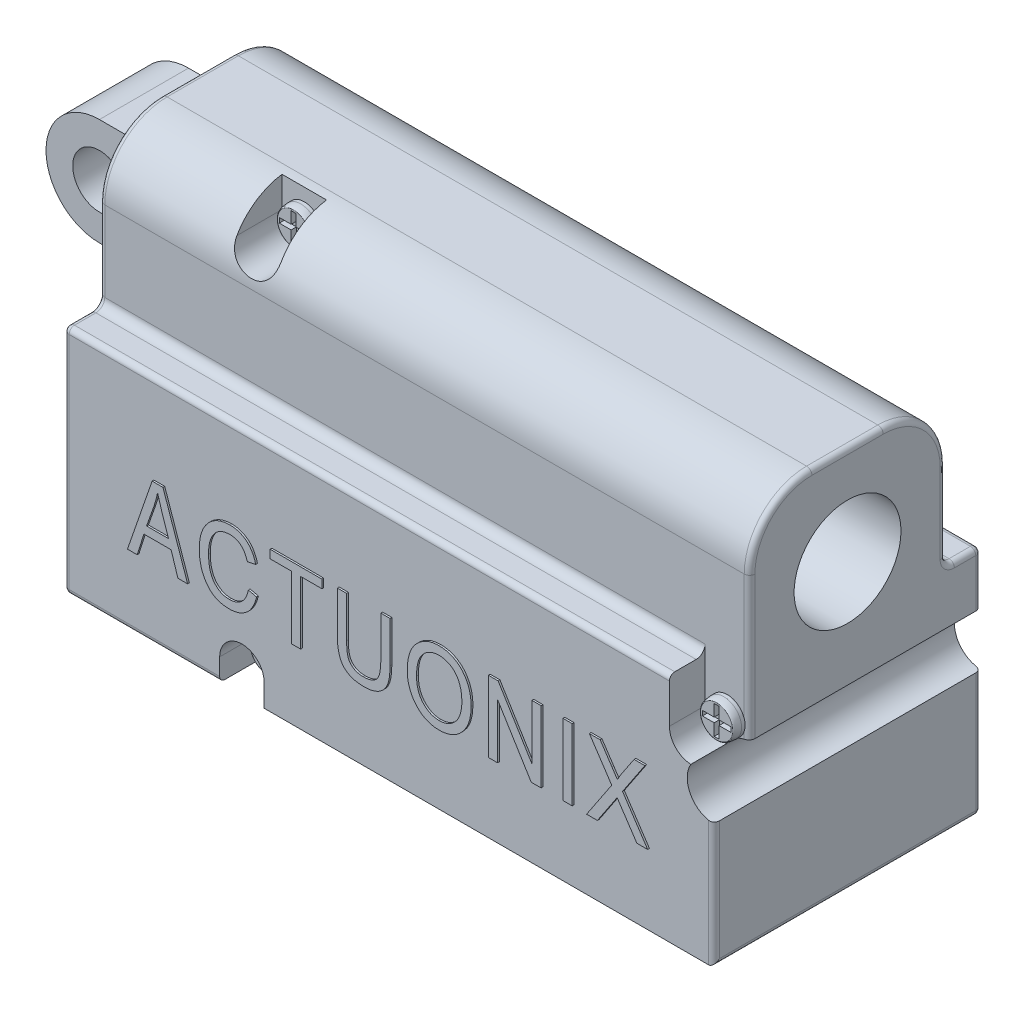
from build123d import *

# Parameters (mm, degrees)
SKETCH1_W             = 36.5
SKETCH1_H             = 21.5
BOSS_EXTRUDE1_DEPTH   = 7.5
SKETCH2_W             = 2
SKETCH2_H             = 8.5
CUT_EXTRUDE1_DEPTH    = 39.782244649
SKETCH3_W             = 5
SKETCH3_H             = 6
BOSS_EXTRUDE2_DEPTH   = 6
SKETCH4_R             = 1.5
CUT_EXTRUDE2_DEPTH    = 29.348280371
SKETCH5_R             = 1.5
CUT_EXTRUDE3_DEPTH    = 31.473349012
SKETCH7_W             = 0.51948052
SKETCH7_H             = 4
LETTERING_DEPTH       = 0.1
SKETCH8_W             = 0.5
SKETCH8_H             = 5.523886488
CUT_EXTRUDE5_DEPTH    = 1
BOSS_EXTRUDE4_DEPTH   = 0.1
SKETCH10_W            = 0.25
SKETCH10_H            = 5.523886488
WIRES_2_DEPTH         = 7
SKETCH11_W            = 0.5
SKETCH11_H            = 7
BOSS_EXTRUDE6_DEPTH   = 0.05
CUT_EXTRUDE6_DEPTH    = 2
CUT_EXTRUDE7_DEPTH    = 3
SKETCH14_R            = 1
BOSS_EXTRUDE7_DEPTH   = 0.6
BOSS_EXTRUDE7_2_DEPTH = 0.6
SKETCH15_W            = 0.6625
SKETCH15_H            = 0.275
SKETCH15_W_2          = 0.275
SKETCH15_H_2          = 0.6625
CUT_EXTRUDE8_DEPTH    = 0.3
SKETCH16_R            = 1
BOSS_EXTRUDE8_DEPTH   = 0.6
SKETCH17_W            = 0.275
SKETCH17_H            = 0.6625
SKETCH17_W_2          = 0.6625
SKETCH17_H_2          = 0.275
CUT_EXTRUDE9_DEPTH    = 0.3
FILLET6_SIZE          = 0.4
FILLET6_SIZE_2        = 0.1
FILLET7_SIZE          = 0.4
FILLET7_SIZE_2        = 0.1
FILLET8_SIZE          = 0.4
FILLET8_SIZE_2        = 0.1
FILLET1_R             = 3.5
FILLET2_R             = 1
FILLET3_R             = 0.5
FILLET4_R             = 0.5
FILLET5_R             = 0.3
SKETCH6_R             = 3
CUT_EXTRUDE4_DEPTH    = 25
SKETCH18_W            = 11.28780457
SKETCH18_H            = 8.884468651
CUT_EXTRUDE10_DEPTH   = 34.11547981


with BuildPart() as part:
    # Sketch1 → Boss-Extrude1 (new, symmetric)
    with BuildSketch(Plane.XY):
        Rectangle(SKETCH1_W, SKETCH1_H)
    extrude(amount=BOSS_EXTRUDE1_DEPTH, both=True)

    # Sketch2 → Cut-Extrude1 (cut, through all)
    with BuildSketch(Plane(origin=(18.25, 0, 0), x_dir=(0, 0, -1), z_dir=(1, 0, 0))):
        with Locations((-6.5, 6.5)):
            Rectangle(SKETCH2_W, SKETCH2_H)
        with Locations((6.5, 6.5)):
            Rectangle(SKETCH2_W, SKETCH2_H)
    extrude(amount=-CUT_EXTRUDE1_DEPTH, mode=Mode.SUBTRACT)

    # Sketch3 → Boss-Extrude2 (add)
    with BuildSketch(Plane.ZY.offset(18.25)):
        with Locations((0, 5.25)):
            Rectangle(SKETCH3_W, SKETCH3_H)
    extrude(amount=BOSS_EXTRUDE2_DEPTH)

    # Sketch4 → Cut-Extrude2 (cut, through all)
    with BuildSketch(Plane.XY.offset(2.5)):
        with BuildLine():
            ThreePointArc((-24.25, 5.25), (-23.371320344, 7.371320344), (-21.25, 8.25))
            Line((-21.25, 8.25), (-24.25, 8.25))
            Line((-24.25, 8.25), (-24.25, 5.25))
        make_face()
        with BuildLine():
            Line((-24.25, 2.25), (-21.25, 2.25))
            ThreePointArc((-21.25, 2.25), (-23.371320344, 3.128679656), (-24.25, 5.25))
            Line((-24.25, 5.25), (-24.25, 2.25))
        make_face()
        with Locations((-21.25, 5.25)):
            Circle(SKETCH4_R)
    extrude(amount=-CUT_EXTRUDE2_DEPTH, mode=Mode.SUBTRACT)

    # Sketch5 → Cut-Extrude3 (cut, through all)
    with BuildSketch(Plane.XY.offset(7.5)):
        with Locations((18.25, -2.25)):
            Circle(SKETCH5_R)
    extrude(amount=-CUT_EXTRUDE3_DEPTH, mode=Mode.SUBTRACT)

    # Sketch7 → Lettering (add)
    # profile 1 of 8: a face of its own
    with BuildSketch(Plane.XY.offset(7.5)):
        Polygon((-14.576623377, -6.75), (-13.191071429, -2.75), (-12.58474026, -2.75), (-11.2, -6.75), (-11.744642857, -6.75), (-12.125324675, -5.555194805), (-13.651298701, -5.555194805), (-14.031980519, -6.75), align=None)
        with BuildLine():
            Line((-13.501948052, -5.087662338), (-12.274675325, -5.087662338))
            Line((-12.274675325, -5.087662338), (-12.639935065, -3.988636364))
            add(Edge.make_bspline(
                [(-12.639935065, -3.988636364), (-12.65351375, -3.947527264), (-12.680027416, -3.86725786), (-12.717907401, -3.749746161), (-12.754167393, -3.63825963), (-12.786379727, -3.532378588), (-12.815469797, -3.432419975), (-12.842520621, -3.338609172), (-12.866920344, -3.250751988), (-12.881375447, -3.193748887), (-12.888311688, -3.166396104)],
                knots=[0, 0, 0, 0, 1.209410234, 2.361487807, 3.449058128, 4.484314046, 5.452976395, 6.357250795, 7.211731278, 8, 8, 8, 8], degree=3))
            add(Edge.make_bspline(
                [(-12.888311688, -3.166396104), (-12.901124878, -3.230075207), (-12.926741471, -3.357384774), (-12.973319058, -3.547258788), (-13.027450773, -3.736275415), (-13.069383114, -3.861081563), (-13.090422078, -3.923701299)],
                knots=[0, 0, 0, 0, 0.993501098, 1.986243324, 2.98962581, 4, 4, 4, 4], degree=3))
            Line((-13.090422078, -3.923701299), (-13.501948052, -5.087662338))
        make_face(mode=Mode.SUBTRACT)
    # profile 2 of 8: a face of its own
    with BuildSketch(Plane.XY.offset(7.5)):
        with BuildLine():
            Line((-7.792207792, -5.347402597), (-7.324675325, -5.451298701))
            add(Edge.make_bspline(
                [(-7.324675325, -5.451298701), (-7.338507843, -5.506447179), (-7.365542684, -5.614231621), (-7.418142329, -5.768179781), (-7.476165414, -5.912074032), (-7.542738908, -6.04496921), (-7.617774687, -6.166698293), (-7.698608355, -6.278963676), (-7.788572676, -6.379120178), (-7.885390202, -6.468700678), (-7.988420918, -6.547487897), (-8.097526444, -6.615465217), (-8.21190664, -6.673069348), (-8.331730731, -6.720257116), (-8.456909189, -6.757236415), (-8.587689795, -6.782430923), (-8.723834237, -6.799756731), (-8.816502321, -6.801209252), (-8.863636364, -6.801948052)],
                knots=[0, 0, 0, 0, 1.220293167, 2.384990924, 3.489669754, 4.549651254, 5.57188532, 6.557220986, 7.51582152, 8.457228578, 9.385586102, 10.296327526, 11.213420288, 12.131450933, 13.057916225, 14.011504525, 14.988585638, 16, 16, 16, 16], degree=3))
            add(Edge.make_bspline(
                [(-8.863636364, -6.801948052), (-8.905058048, -6.801419118), (-8.986688304, -6.80037674), (-9.106460448, -6.789348014), (-9.221790988, -6.772704962), (-9.332301166, -6.747983357), (-9.438876482, -6.717626517), (-9.540431245, -6.679115624), (-9.637597996, -6.634671315), (-9.729668118, -6.582173073), (-9.818184169, -6.52293947), (-9.901393032, -6.454223711), (-9.981739073, -6.378558724), (-10.056960745, -6.293706075), (-10.128817557, -6.200858259), (-10.195643045, -6.099262848), (-10.259460729, -5.989995939), (-10.318128719, -5.872834798), (-10.372152418, -5.748765883), (-10.417667338, -5.617992469), (-10.45807264, -5.48252656), (-10.489241164, -5.341069606), (-10.514621378, -5.194576317), (-10.531927893, -5.042251512), (-10.544131522, -4.884668646), (-10.545008707, -4.777621958), (-10.545454545, -4.723214286)],
                knots=[0, 0, 0, 0, 0.987444875, 1.945970532, 2.865691915, 3.764214811, 4.644225399, 5.505809035, 6.35159498, 7.189444901, 8.03046832, 8.887959934, 9.759606025, 10.659725721, 11.58885776, 12.556911331, 13.557234418, 14.604595256, 15.679628512, 16.781526208, 17.904378674, 19.048529781, 20.233287979, 21.448073357, 22.70295484, 24, 24, 24, 24], degree=3))
            add(Edge.make_bspline(
                [(-10.545454545, -4.723214286), (-10.545011349, -4.66961834), (-10.544141797, -4.564463033), (-10.531999977, -4.410110988), (-10.514590546, -4.261860909), (-10.489608069, -4.119785185), (-10.456867106, -3.984140374), (-10.418547579, -3.854397692), (-10.370736364, -3.731716174), (-10.317802854, -3.61476854), (-10.257196775, -3.505175571), (-10.19226788, -3.401844132), (-10.12266503, -3.304803719), (-10.046935004, -3.21551783), (-9.966492373, -3.133172157), (-9.88076966, -3.058318847), (-9.790363002, -2.989688546), (-9.694774651, -2.928209444), (-9.595035603, -2.874060447), (-9.492559875, -2.826818588), (-9.387380921, -2.786790523), (-9.279140063, -2.754317756), (-9.167928456, -2.729124127), (-9.053719381, -2.711644238), (-8.936952756, -2.69943788), (-8.85798646, -2.698516426), (-8.818181818, -2.698051948)],
                knots=[0, 0, 0, 0, 1.28714434, 2.525378668, 3.716880711, 4.871983872, 5.988084826, 7.067553269, 8.118870607, 9.148405561, 10.148997021, 11.124535523, 12.078797495, 13.015004836, 13.934205159, 14.841541352, 15.746266633, 16.658501295, 17.568835417, 18.470356714, 19.36722721, 20.269895764, 21.182824756, 22.103907324, 23.044234137, 24, 24, 24, 24], degree=3))
            add(Edge.make_bspline(
                [(-8.818181818, -2.698051948), (-8.774865529, -2.699077146), (-8.689364601, -2.701100759), (-8.563463317, -2.714423933), (-8.44278129, -2.739814007), (-8.325999165, -2.771248402), (-8.214589884, -2.815279728), (-8.107070087, -2.866627524), (-8.004999519, -2.929215416), (-7.907714063, -3.000508735), (-7.815798757, -3.080784043), (-7.730996424, -3.170482234), (-7.65412937, -3.269374023), (-7.582563764, -3.375839973), (-7.520641009, -3.49279894), (-7.464660804, -3.617740579), (-7.415324234, -3.751604995), (-7.38972891, -3.845023973), (-7.376623377, -3.892857143)],
                knots=[0, 0, 0, 0, 1.022275984, 2.017844681, 2.982003421, 3.930067028, 4.867949935, 5.804571516, 6.73859987, 7.688703687, 8.647902883, 9.614426418, 10.596638918, 11.600688327, 12.637652993, 13.715085674, 14.83005897, 16, 16, 16, 16], degree=3))
            Line((-7.376623377, -3.892857143), (-7.844155844, -3.996753247))
            add(Edge.make_bspline(
                [(-7.844155844, -3.996753247), (-7.85464396, -3.963093169), (-7.875118898, -3.897381842), (-7.910746313, -3.802881022), (-7.950735459, -3.715256431), (-7.993369371, -3.63331355), (-8.041555622, -3.558825531), (-8.092708175, -3.490390556), (-8.147188722, -3.427847472), (-8.206639604, -3.372904194), (-8.26930522, -3.323943922), (-8.335614238, -3.281043995), (-8.406288264, -3.245676607), (-8.480643548, -3.216119319), (-8.558693841, -3.193541851), (-8.640415775, -3.177299478), (-8.725944033, -3.167354867), (-8.78433431, -3.166182516), (-8.814123377, -3.165584416)],
                knots=[0, 0, 0, 0, 1.220199917, 2.382078738, 3.492743967, 4.55265868, 5.57620237, 6.559539882, 7.508379445, 8.442687966, 9.356879029, 10.258317357, 11.171356441, 12.087847118, 13.024359035, 13.979417542, 14.969156017, 16, 16, 16, 16], degree=3))
            add(Edge.make_bspline(
                [(-8.814123377, -3.165584416), (-8.843907365, -3.16595512), (-8.902509009, -3.166684503), (-8.988943327, -3.175352184), (-9.0722254, -3.187946225), (-9.15243404, -3.206095286), (-9.229896696, -3.228620066), (-9.304200284, -3.256981298), (-9.375653201, -3.29049159), (-9.443537771, -3.329638096), (-9.50923178, -3.373067105), (-9.569737131, -3.424388832), (-9.628696883, -3.479047249), (-9.683214877, -3.540926969), (-9.735219746, -3.607852728), (-9.782729721, -3.681315876), (-9.827899349, -3.759667056), (-9.869001832, -3.844032858), (-9.906587995, -3.933783311), (-9.937911501, -4.029797062), (-9.965938753, -4.130923833), (-9.987075242, -4.238509187), (-10.0055166, -4.35129149), (-10.017151264, -4.47031038), (-10.024654274, -4.594869102), (-10.025528761, -4.679912545), (-10.025974026, -4.723214286)],
                knots=[0, 0, 0, 0, 0.959151106, 1.887182805, 2.795730556, 3.671188784, 4.534456022, 5.392426551, 6.230734837, 7.074012927, 7.915306618, 8.763480608, 9.626703842, 10.503289512, 11.416840776, 12.354847438, 13.319212219, 14.328838396, 15.376139039, 16.451111898, 17.580236346, 18.754612153, 19.981261172, 21.260541797, 22.605144554, 24, 24, 24, 24], degree=3))
            add(Edge.make_bspline(
                [(-10.025974026, -4.723214286), (-10.025216355, -4.788190237), (-10.023746062, -4.914278851), (-10.007373086, -5.097108473), (-9.984547863, -5.2680491), (-9.948168183, -5.425716837), (-9.904201955, -5.571399829), (-9.849011943, -5.704129326), (-9.783831944, -5.82443621), (-9.70922545, -5.932255067), (-9.624960843, -6.026411591), (-9.534861704, -6.109254575), (-9.437322685, -6.178607975), (-9.333608141, -6.23633287), (-9.222557091, -6.279745026), (-9.105399806, -6.311928002), (-8.981390522, -6.330628836), (-8.896436705, -6.333136111), (-8.853084416, -6.334415584)],
                knots=[0, 0, 0, 0, 1.385190916, 2.688022233, 3.911987166, 5.059762054, 6.134700928, 7.153741068, 8.119372781, 9.047723265, 9.942790484, 10.808687405, 11.652464049, 12.489168403, 13.333457801, 14.188677601, 15.075674591, 16, 16, 16, 16], degree=3))
            add(Edge.make_bspline(
                [(-8.853084416, -6.334415584), (-8.820853935, -6.333597523), (-8.757274054, -6.331983762), (-8.663862161, -6.320369397), (-8.57364377, -6.301705003), (-8.486741524, -6.275240178), (-8.403682176, -6.239363344), (-8.322852742, -6.198639095), (-8.246204237, -6.148400487), (-8.173309164, -6.090939494), (-8.104651099, -6.025845523), (-8.04198119, -5.952291289), (-7.985059084, -5.870672783), (-7.93395343, -5.781324032), (-7.889260229, -5.683952741), (-7.850496283, -5.578881675), (-7.816893925, -5.466173851), (-7.800559767, -5.387586069), (-7.792207792, -5.347402597)],
                knots=[0, 0, 0, 0, 0.973965102, 1.921305061, 2.840267794, 3.755913685, 4.661093029, 5.571759363, 6.488098773, 7.425504551, 8.374078967, 9.342639517, 10.340814204, 11.377406182, 12.449421082, 13.574960536, 14.760029829, 16, 16, 16, 16], degree=3))
        make_face()
    # profile 3 of 8: a face of its own
    with BuildSketch(Plane.XY.offset(7.5)):
        Polygon((-5.371428571, -6.75), (-5.371428571, -3.217532468), (-6.566233766, -3.217532468), (-6.566233766, -2.75), (-3.657142857, -2.75), (-3.657142857, -3.217532468), (-4.851948052, -3.217532468), (-4.851948052, -6.75), align=None)
    # profile 4 of 8: a face of its own
    with BuildSketch(Plane.XY.offset(7.5)):
        with BuildLine():
            Line((-0.353246753, -2.75), (0.166233766, -2.75))
            Line((0.166233766, -2.75), (0.166233766, -5.051948052))
            add(Edge.make_bspline(
                [(0.166233766, -5.051948052), (0.166106517, -5.099037656), (0.165857738, -5.191100992), (0.15852212, -5.326117275), (0.149801751, -5.454842727), (0.13443683, -5.576805544), (0.117488578, -5.692410735), (0.093989325, -5.801298053), (0.068988455, -5.904373617), (0.037682196, -6.000781849), (0.002181284, -6.091728394), (-0.040348515, -6.17760277), (-0.089650309, -6.258641274), (-0.146121244, -6.334511002), (-0.208790305, -6.405456425), (-0.27840575, -6.471244388), (-0.353711945, -6.533503125), (-0.43678827, -6.588921156), (-0.525053103, -6.639784798), (-0.620243332, -6.682531087), (-0.720397235, -6.720049585), (-0.826900639, -6.749923013), (-0.938838266, -6.773684654), (-1.056932246, -6.789092122), (-1.180406741, -6.800490531), (-1.26474438, -6.801455507), (-1.307792208, -6.801948052)],
                knots=[0, 0, 0, 0, 1.284233155, 2.510762038, 3.68754514, 4.802511647, 5.862997644, 6.873298535, 7.839874488, 8.754776576, 9.635987794, 10.500727489, 11.365215201, 12.219849526, 13.077283435, 13.943816381, 14.830204351, 15.739043759, 16.664511467, 17.605735432, 18.581816022, 19.579339969, 20.620047603, 21.700302784, 22.826182843, 24, 24, 24, 24], degree=3))
            add(Edge.make_bspline(
                [(-1.307792208, -6.801948052), (-1.367914729, -6.801087624), (-1.484683449, -6.799416519), (-1.653962117, -6.779930449), (-1.811907239, -6.750706399), (-1.958119947, -6.708736002), (-2.092199466, -6.653679057), (-2.21593425, -6.588548181), (-2.326666538, -6.508968288), (-2.426989347, -6.41785641), (-2.515428446, -6.310361595), (-2.590654135, -6.184281346), (-2.653408646, -6.039887724), (-2.706497152, -5.87808629), (-2.746296392, -5.697486299), (-2.773706527, -5.498508886), (-2.792192428, -5.281460489), (-2.793911495, -5.130453007), (-2.794805195, -5.051948052)],
                knots=[0, 0, 0, 0, 1.084700636, 2.106683185, 3.071181054, 3.981486811, 4.846658298, 5.683481954, 6.499279031, 7.301173437, 8.123435026, 9.00201022, 9.942153052, 10.959879466, 12.071198949, 13.274996868, 14.583340067, 16, 16, 16, 16], degree=3))
            Line((-2.794805195, -5.051948052), (-2.794805195, -2.75))
            Line((-2.794805195, -2.75), (-2.275324675, -2.75))
            Line((-2.275324675, -2.75), (-2.275324675, -5.054383117))
            add(Edge.make_bspline(
                [(-2.275324675, -5.054383117), (-2.274954117, -5.097945997), (-2.274238152, -5.18211482), (-2.27044452, -5.303662905), (-2.263192596, -5.416011758), (-2.252971182, -5.518952866), (-2.239046836, -5.612324752), (-2.223277621, -5.696474905), (-2.203689357, -5.771214629), (-2.175581115, -5.857791863), (-2.128750266, -5.953063604), (-2.058236743, -6.0540515), (-1.971803871, -6.140450387), (-1.870009879, -6.211472991), (-1.754600746, -6.266409988), (-1.627614415, -6.306304226), (-1.489132078, -6.329933112), (-1.393113258, -6.332888648), (-1.343506494, -6.334415584)],
                knots=[0, 0, 0, 0, 1.141221317, 2.204979448, 3.185171586, 4.090023792, 4.913976812, 5.657653947, 6.331552786, 6.936718419, 8.039865504, 9.097822674, 10.150304947, 11.223934664, 12.33346159, 13.485657179, 14.701000362, 16, 16, 16, 16], degree=3))
            add(Edge.make_bspline(
                [(-1.343506494, -6.334415584), (-1.301535171, -6.333701785), (-1.22038054, -6.332321603), (-1.103155106, -6.319916618), (-0.994539505, -6.300330005), (-0.895251107, -6.270713859), (-0.804493148, -6.234726325), (-0.72280408, -6.189588042), (-0.650565205, -6.135715964), (-0.585142843, -6.073826183), (-0.528772382, -5.998969424), (-0.482273398, -5.908827228), (-0.441644506, -5.804126432), (-0.40889101, -5.683863986), (-0.384481359, -5.547988392), (-0.365740633, -5.39736414), (-0.35579352, -5.230922362), (-0.354121229, -5.115000898), (-0.353246753, -5.054383117)],
                knots=[0, 0, 0, 0, 1.066557885, 2.062267932, 2.99298675, 3.867801605, 4.69154568, 5.470429187, 6.232460853, 6.976655931, 7.752436183, 8.601598288, 9.546689851, 10.60288661, 11.764278551, 13.053225541, 14.459069418, 16, 16, 16, 16], degree=3))
            Line((-0.353246753, -5.054383117), (-0.353246753, -2.75))
        make_face()
    # profile 5 of 8: a face of its own
    with BuildSketch(Plane.XY.offset(7.5)):
        with BuildLine():
            add(Edge.make_bspline(
                [(1.132467532, -4.80275974), (1.133923282, -4.720712905), (1.136759891, -4.560840007), (1.161679144, -4.328603483), (1.200722589, -4.110701229), (1.256639277, -3.907597013), (1.328853741, -3.718984757), (1.417567745, -3.544925791), (1.522752951, -3.385679567), (1.643278854, -3.242099004), (1.775046341, -3.114070461), (1.916597063, -3.003106148), (2.065349838, -2.907895165), (2.223237269, -2.83188098), (2.387937512, -2.77067406), (2.561328064, -2.729368149), (2.741987141, -2.702055126), (2.865319052, -2.699399791), (2.927922078, -2.698051948)],
                knots=[0, 0, 0, 0, 1.263431084, 2.461866925, 3.593164393, 4.669969747, 5.701635473, 6.698784988, 7.673171325, 8.6347017, 9.580754227, 10.4978345, 11.40079179, 12.295440074, 13.191979127, 14.101672174, 15.036412681, 16, 16, 16, 16], degree=3))
            add(Edge.make_bspline(
                [(2.927922078, -2.698051948), (2.968805472, -2.698863121), (3.04964745, -2.700467118), (3.169454102, -2.712308831), (3.286716489, -2.730568332), (3.4012836, -2.757792745), (3.513541078, -2.791453229), (3.622576994, -2.834225994), (3.728981239, -2.883587122), (3.832103985, -2.940432788), (3.931306633, -3.00445781), (4.025372753, -3.076221447), (4.115142459, -3.154029126), (4.198651596, -3.239567163), (4.276971699, -3.331823091), (4.349958844, -3.430789532), (4.417485705, -3.536961502), (4.479819089, -3.649328517), (4.535894239, -3.767983236), (4.58490147, -3.892314119), (4.624930615, -4.022811552), (4.659462722, -4.158098406), (4.68512745, -4.299445499), (4.703894368, -4.446000753), (4.714198758, -4.598337418), (4.71597805, -4.701555051), (4.716883117, -4.754058442)],
                knots=[0, 0, 0, 0, 0.961926932, 1.902094409, 2.830547297, 3.752537684, 4.67095983, 5.586109941, 6.506163741, 7.429450247, 8.354841813, 9.281874629, 10.211440208, 11.14791392, 12.091953956, 13.057204343, 14.039212897, 15.050927152, 16.079075996, 17.125436721, 18.192721555, 19.289102544, 20.409258653, 21.570932135, 22.764413651, 24, 24, 24, 24], degree=3))
            add(Edge.make_bspline(
                [(4.716883117, -4.754058442), (4.715434725, -4.825803315), (4.712597046, -4.966365304), (4.691723102, -5.172223718), (4.654810259, -5.367768351), (4.60504858, -5.553513469), (4.539762915, -5.728647848), (4.460790936, -5.893890282), (4.366916924, -6.048900336), (4.292800993, -6.143550713), (4.255844156, -6.190746753)],
                knots=[0, 0, 0, 0, 1.117937363, 2.190254058, 3.21977568, 4.215977455, 5.183179778, 6.127956884, 7.066532784, 8, 8, 8, 8], degree=3))
            add(Edge.make_bspline(
                [(4.255844156, -6.190746753), (4.212736089, -6.239335039), (4.127990849, -6.334853725), (3.985234384, -6.459837857), (3.832979942, -6.566114165), (3.670304856, -6.652824504), (3.497663342, -6.719533615), (3.315355026, -6.767643994), (3.123098064, -6.796358323), (2.991602002, -6.800062673), (2.924675325, -6.801948052)],
                knots=[0, 0, 0, 0, 1.027498799, 2.019938215, 2.995447625, 3.961203776, 4.930827592, 5.918866746, 6.940779422, 8, 8, 8, 8], degree=3))
            add(Edge.make_bspline(
                [(2.924675325, -6.801948052), (2.857202163, -6.800130456), (2.72484619, -6.796565043), (2.531407986, -6.766976768), (2.348597823, -6.717179221), (2.175351249, -6.64864813), (2.012381807, -6.559727397), (1.859791692, -6.450785271), (1.717041082, -6.322703511), (1.633021824, -6.224496175), (1.59025974, -6.174512987)],
                knots=[0, 0, 0, 0, 1.059233302, 2.077801789, 3.064242134, 4.02921826, 4.997034042, 5.972070175, 6.967873479, 8, 8, 8, 8], degree=3))
            add(Edge.make_bspline(
                [(1.59025974, -6.174512987), (1.553692264, -6.126410451), (1.481020792, -6.030815062), (1.387362405, -5.877084784), (1.308345312, -5.715942531), (1.244454233, -5.547272844), (1.19349218, -5.371778381), (1.158195704, -5.188659016), (1.136700286, -4.998079798), (1.133893554, -4.868563394), (1.132467532, -4.80275974)],
                knots=[0, 0, 0, 0, 0.982628282, 1.952802089, 2.92341525, 3.898778707, 4.88381997, 5.893076978, 6.929531471, 8, 8, 8, 8], degree=3))
        make_face()
        with BuildLine():
            add(Edge.make_bspline(
                [(1.651948052, -4.809253247), (1.652864537, -4.868021669), (1.654647148, -4.982329275), (1.673474377, -5.148529855), (1.700909785, -5.305165046), (1.741716353, -5.451545482), (1.793244468, -5.588187369), (1.858184302, -5.713624144), (1.932810207, -5.830211415), (2.01982115, -5.935028169), (2.114404067, -6.028783036), (2.214579764, -6.111046106), (2.320908746, -6.178869303), (2.430871806, -6.236891198), (2.546559767, -6.280567239), (2.667149773, -6.31149032), (2.79257047, -6.33063918), (2.878070636, -6.333144907), (2.921428571, -6.334415584)],
                knots=[0, 0, 0, 0, 1.266169419, 2.462764717, 3.600931822, 4.690411057, 5.733399321, 6.742780968, 7.729518729, 8.711436491, 9.672276695, 10.596748877, 11.499386426, 12.386230187, 13.272210652, 14.157672736, 15.065738575, 16, 16, 16, 16], degree=3))
            add(Edge.make_bspline(
                [(2.921428571, -6.334415584), (2.965866281, -6.333142526), (3.053247975, -6.330639202), (3.181452281, -6.311629583), (3.304026451, -6.280088986), (3.420835485, -6.234814662), (3.532468745, -6.177880508), (3.638769761, -6.10843423), (3.738963583, -6.02575347), (3.833069133, -5.930837083), (3.919233445, -5.823893241), (3.994584989, -5.704541815), (4.056694604, -5.572505888), (4.108985269, -5.429487558), (4.148048873, -5.274022807), (4.1774696, -5.107269752), (4.194290213, -4.928376222), (4.19634541, -4.805229483), (4.197402597, -4.741883117)],
                knots=[0, 0, 0, 0, 0.927913641, 1.824636478, 2.700513548, 3.566360566, 4.435796468, 5.313567565, 6.212993094, 7.144084972, 8.100806857, 9.07604339, 10.084604769, 11.142951278, 12.251828903, 13.428071361, 14.677006512, 16, 16, 16, 16], degree=3))
            add(Edge.make_bspline(
                [(4.197402597, -4.741883117), (4.196743934, -4.700199797), (4.195446473, -4.618090393), (4.186198834, -4.496465088), (4.171774965, -4.378338036), (4.151671335, -4.263338114), (4.124681563, -4.152037507), (4.092115967, -4.043955175), (4.054450799, -3.938702283), (4.023642361, -3.87128239), (4.008279221, -3.837662338)],
                knots=[0, 0, 0, 0, 1.074070125, 2.115744592, 3.141382573, 4.139785726, 5.122287222, 6.090610392, 7.047851067, 8, 8, 8, 8], degree=3))
            add(Edge.make_bspline(
                [(4.008279221, -3.837662338), (3.982355126, -3.788371618), (3.930975438, -3.690680962), (3.829107481, -3.559342001), (3.708666277, -3.444215978), (3.594544149, -3.362330522), (3.496940189, -3.305351636), (3.421277571, -3.267899505), (3.343759266, -3.236037127), (3.264596977, -3.209981125), (3.183298699, -3.190761729), (3.101010338, -3.175739803), (3.016548254, -3.16784266), (2.959862274, -3.166343343), (2.931168831, -3.165584416)],
                knots=[0, 0, 0, 0, 1.49536845, 2.963712579, 4.445710843, 5.962222937, 6.728422237, 7.483311059, 8.230481807, 8.980551729, 9.72171158, 10.475301985, 11.228224764, 12, 12, 12, 12], degree=3))
            add(Edge.make_bspline(
                [(2.931168831, -3.165584416), (2.885650507, -3.16685026), (2.796385357, -3.169332684), (2.665476996, -3.18833504), (2.540879927, -3.2199527), (2.422301888, -3.264189335), (2.309541902, -3.320185747), (2.203304366, -3.39000171), (2.103402782, -3.472394629), (2.009604144, -3.566612584), (1.924466863, -3.674124392), (1.851546067, -3.796438286), (1.788762917, -3.931472018), (1.738925523, -4.080874609), (1.698920546, -4.243394559), (1.672520309, -4.420037202), (1.654797412, -4.610028562), (1.65291997, -4.741297608), (1.651948052, -4.809253247)],
                knots=[0, 0, 0, 0, 0.927132261, 1.818182038, 2.688547624, 3.541474334, 4.391975012, 5.248173059, 6.125493334, 7.025906057, 7.95225139, 8.911804577, 9.920513176, 10.980385494, 12.115471112, 13.326255262, 14.615850128, 16, 16, 16, 16], degree=3))
        make_face(mode=Mode.SUBTRACT)
    # profile 6 of 8: a face of its own
    with BuildSketch(Plane.XY.offset(7.5)):
        Polygon((5.683116883, -6.75), (5.683116883, -2.75), (6.23262987, -2.75), (8.124675325, -5.82711039), (8.124675325, -2.75), (8.644155844, -2.75), (8.644155844, -6.75), (8.091396104, -6.75), (6.202597403, -3.678571429), (6.202597403, -6.75), align=None)
    # profile 7 of 8: a face of its own
    with BuildSketch(Plane.XY.offset(7.5)):
        with Locations((10.12987013, -4.75)):
            Rectangle(SKETCH7_W, SKETCH7_H)
    # profile 8 of 8: a face of its own
    with BuildSketch(Plane.XY.offset(7.5)):
        with BuildLine():
            Line((11.2, -6.75), (12.611525974, -4.633928571))
            Line((12.611525974, -4.633928571), (11.355844156, -2.75))
            Line((11.355844156, -2.75), (11.961363636, -2.75))
            Line((11.961363636, -2.75), (12.62775974, -3.749188312))
            add(Edge.make_bspline(
                [(12.62775974, -3.749188312), (12.644813819, -3.774615421), (12.677626152, -3.823537607), (12.724763047, -3.894115668), (12.76767908, -3.959299815), (12.807668423, -4.018679244), (12.843884903, -4.072366845), (12.875891529, -4.120924459), (12.904052295, -4.163838972), (12.922103832, -4.190495004), (12.930519481, -4.202922078)],
                knots=[0, 0, 0, 0, 1.347087419, 2.591818869, 3.734203168, 4.78083933, 5.741632408, 6.58356599, 7.339656759, 8, 8, 8, 8], degree=3))
            add(Edge.make_bspline(
                [(12.930519481, -4.202922078), (12.945430396, -4.173033852), (12.977378041, -4.108996306), (13.033585061, -4.009692123), (13.100560752, -3.900392053), (13.15024142, -3.825329517), (13.176461039, -3.785714286)],
                knots=[0, 0, 0, 0, 0.826842382, 1.771565708, 2.823914786, 4, 4, 4, 4], degree=3))
            Line((13.176461039, -3.785714286), (13.867207792, -2.75))
            Line((13.867207792, -2.75), (14.472727273, -2.75))
            Line((14.472727273, -2.75), (13.217045455, -4.633116883))
            Line((13.217045455, -4.633116883), (14.628571429, -6.75))
            Line((14.628571429, -6.75), (14.023051948, -6.75))
            Line((14.023051948, -6.75), (13.058766234, -5.303571429))
            add(Edge.make_bspline(
                [(13.058766234, -5.303571429), (13.033638229, -5.265669748), (12.985662808, -5.193306298), (12.937311934, -5.121193195), (12.914285714, -5.086850649)],
                knots=[0, 0, 0, 0, 1.047536591, 2, 2, 2, 2], degree=3))
            add(Edge.make_bspline(
                [(12.914285714, -5.086850649), (12.893759238, -5.117718838), (12.855947307, -5.174581291), (12.80366759, -5.252104953), (12.762812669, -5.315864382), (12.737678529, -5.352590056), (12.726785714, -5.368506494)],
                knots=[0, 0, 0, 0, 1.314685404, 2.421788902, 3.316023523, 4, 4, 4, 4], degree=3))
            Line((12.726785714, -5.368506494), (11.805519481, -6.75))
            Line((11.805519481, -6.75), (11.2, -6.75))
        make_face()
    extrude(amount=LETTERING_DEPTH)

    # Sketch8 → Cut-Extrude5 (cut)
    with BuildSketch(Plane.XZ.offset(10.75)):
        with Locations((13.25, 0.738056756)):
            Rectangle(SKETCH8_W, SKETCH8_H)
    extrude(amount=-CUT_EXTRUDE5_DEPTH, mode=Mode.SUBTRACT)

    # Sketch9 → Boss-Extrude4 (add)
    with BuildSketch(Plane.XZ.offset(10.75)):
        with BuildLine():
            Line((14.5, -2.75), (14.5, 3.5))
            Line((14.5, 3.5), (13.5, 3.5))
            Line((13.5, 3.5), (13.5, -2.023886488))
            Line((13.5, -2.023886488), (13, -2.023886488))
            Line((13, -2.023886488), (13, 3.5))
            Line((13, 3.5), (12, 3.5))
            Line((12, 3.5), (12, -2.75))
            ThreePointArc((12, -2.75), (13.25, -4), (14.5, -2.75))
        make_face()
    extrude(amount=BOSS_EXTRUDE4_DEPTH)

    # Sketch12 → Cut-Extrude6 (cut)
    with BuildSketch(Plane.XY.offset(7.5)):
        with BuildLine():
            ThreePointArc((18.25, 2.25), (17, 3.5), (15.75, 2.25))
            Line((15.75, 2.25), (15.75, -0.25))
            ThreePointArc((15.75, -0.25), (16.099134325, -1.11656854), (16.951505656, -1.499058965))
            ThreePointArc((16.951505656, -1.499058965), (17.500470665, -0.950690269), (18.25, -0.75))
            Line((18.25, -0.75), (18.25, 2.25))
        make_face()
        with BuildLine():
            Line((-9.5, -9.5), (-9.5, -10.75))
            ThreePointArc((-9.5, -10.75), (-8.25, -12), (-7, -10.75))
            Line((-7, -10.75), (-7, -9.5))
            ThreePointArc((-7, -9.5), (-8.25, -8.25), (-9.5, -9.5))
        make_face()
    extrude(amount=-CUT_EXTRUDE6_DEPTH, mode=Mode.SUBTRACT)

    # Sketch13 → Cut-Extrude7 (cut)
    with BuildSketch(Plane.XY.offset(5.5)):
        with BuildLine():
            Line((-8.5, 10.75), (-8.5, 9))
            ThreePointArc((-8.5, 9), (-9.75, 7.75), (-11, 9))
            Line((-11, 9), (-11, 10.75))
            ThreePointArc((-11, 10.75), (-9.75, 12), (-8.5, 10.75))
        make_face()
    extrude(amount=-CUT_EXTRUDE7_DEPTH, mode=Mode.SUBTRACT)

    # Fillet1
    # the kernel refuses this fillet: 3.5 mm, written as the material it takes off along each edge
    with BuildSketch(Plane(origin=(-2.25, 10.75, 5.5), x_dir=(0, 0, -1), z_dir=(-1, 0, 0))) as fillet1_piece_1:
        with BuildLine():
            CenterArc((FILLET1_R, FILLET1_R), FILLET1_R, 180, 90)
            Line((0, FILLET1_R), (0, 0))
            Line((0, 0), (FILLET1_R, 0))
        make_face()
    extrude(amount=24.75, mode=Mode.SUBTRACT)
    with BuildSketch(Plane(origin=(27, 10.75, -5.5), x_dir=(0, 0, 1), z_dir=(-1, 0, 0))) as fillet1_piece_2:
        with BuildLine():
            CenterArc((FILLET1_R, -FILLET1_R), FILLET1_R, 90, 90)
            Line((0, -FILLET1_R), (0, 0))
            Line((0, 0), (FILLET1_R, 0))
        make_face()
    extrude(amount=54, mode=Mode.SUBTRACT)
    with BuildSketch(Plane(origin=(27, 10.75, 5.5), x_dir=(0, 0, -1), z_dir=(-1, 0, 0))) as fillet1_piece_3:
        with BuildLine():
            CenterArc((FILLET1_R, FILLET1_R), FILLET1_R, 180, 90)
            Line((0, FILLET1_R), (0, 0))
            Line((0, 0), (FILLET1_R, 0))
        make_face()
    extrude(amount=44.25, mode=Mode.SUBTRACT)

    # Fillet2
    fillet2_edges = [part.edges().sort_by_distance(p)[0] for p in [
        (-18.25, 8.25, 0),
        (-18.25, 2.25, 0),
    ]]
    fillet(fillet2_edges, radius=FILLET2_R)

    # Fillet3
    fillet3_edges = [part.edges().sort_by_distance(p)[0] for p in [
        (-18.25, 5.25, 2.5),
        (-18.25, 5.25, -2.5),
    ]]
    fillet(fillet3_edges, radius=FILLET3_R)

    # Fillet4
    fillet4_edges = [part.edges().sort_by_distance(p)[0] for p in [
        (-1.25, 2.25, 5.5),
        (0, 2.25, -5.5),
    ]]
    fillet(fillet4_edges, radius=FILLET4_R)

    # Fillet5
    fillet5_edges = [part.edges().sort_by_distance(p)[0] for p in [
        (-13.875, -10.75, 7.5),
        (-18.25, -4.25, -7.5),
        (-18.25, -4.25, 7.5),
        (-1.25, 2.25, 7.5),
        (0, 2.25, -7.5),
        (18.25, -7.25, 7.5),
        (18.25, 5, -5.5),
        (-18.25, 5, -5.5),
        (18.25, 3.25, 5.5),
        (18.25, 10.75, 0),
        (18.25, 9.724873734, 4.474873734),
        (18.25, 9.724873734, -4.474873734),
        (-18.25, 10.75, 0),
        (-18.25, 5, 5.5),
        (-18.25, 9.724873734, 4.474873734),
        (-18.25, 9.724873734, -4.474873734),
        (0, -10.75, -7.5),
        (-18.25, 2.25, 6.75),
        (18.25, 2.25, -6.75),
        (-18.25, 2.25, -6.75),
        (-18.25, 2.396446609, 5.646446609),
        (18.25, 2.396446609, -5.646446609),
        (-18.25, 2.396446609, -5.646446609),
        (18.25, -7.25, -7.5),
        (18.25, -10.75, 0),
        (-18.25, -10.75, 0),
        (18.25, 0.75, -7.5),
    ]]
    fillet(fillet5_edges, radius=FILLET5_R)

    # Sketch6 → Cut-Extrude4 (cut)
    with BuildSketch(Plane(origin=(18.25, 0, 0), x_dir=(0, 0, -1), z_dir=(1, 0, 0))):
        with Locations((0, 5.25)):
            Circle(SKETCH6_R)
    extrude(amount=-CUT_EXTRUDE4_DEPTH, mode=Mode.SUBTRACT)


with BuildPart() as body_2:
    # Sketch10 → Wires 2 (new body)
    with BuildSketch(Plane.XZ.offset(9.75)):
        with Locations((13.25, 0.738056756)):
            Rectangle(SKETCH10_W, SKETCH10_H)
    extrude(amount=WIRES_2_DEPTH)

    # Sketch11 → Boss-Extrude6 (add)
    with BuildSketch(Plane(origin=(13.375, 0, 0), x_dir=(0, 0, -1), z_dir=(1, 0, 0))):
        with Locations((1.272068306, -13.25)):
            Rectangle(SKETCH11_W, SKETCH11_H)
        with Locations((0.272068306, -13.25)):
            Rectangle(SKETCH11_W, SKETCH11_H)
        with Locations((-0.727931694, -13.25)):
            Rectangle(SKETCH11_W, SKETCH11_H)
        with Locations((-1.727931694, -13.25)):
            Rectangle(SKETCH11_W, SKETCH11_H)
        with Locations((-2.727931694, -13.25)):
            Rectangle(SKETCH11_W, SKETCH11_H)
    boss_extrude6 = extrude(amount=BOSS_EXTRUDE6_DEPTH)

    # Mirror1: Boss-Extrude6 across plane
    add(boss_extrude6.mirror(Plane(origin=(13.25, 0, 0), x_dir=(0, 0, 1), z_dir=(1, 0, 0))))

    # Sketch18 → Cut-Extrude10 (cut, through all)
    with BuildSketch(Plane(origin=(0, 0, -7.5), x_dir=(-1, 0, 0), z_dir=(0, 0, -1))):
        with Locations((-13.70478252, -15.713533484)):
            Rectangle(SKETCH18_W, SKETCH18_H)
    extrude(amount=-CUT_EXTRUDE10_DEPTH, mode=Mode.SUBTRACT)


with BuildPart() as body_3:
    # Sketch14 → Boss-Extrude7 (new body)
    with BuildSketch(Plane.XY.offset(5.5)):
        with Locations((-8.25, -9.5)):
            Circle(SKETCH14_R)
    extrude(amount=BOSS_EXTRUDE7_DEPTH)


with BuildPart() as body_4:
    # Sketch14 → Boss-Extrude7 2 (new body)
    with BuildSketch(Plane.XY.offset(5.5)):
        with Locations((17, -0.084936491)):
            Circle(SKETCH14_R)
    extrude(amount=BOSS_EXTRUDE7_2_DEPTH)


with BuildPart() as cut_extrude8_tool:
    # Sketch15 → Cut-Extrude8 (new body)
    with BuildSketch(Plane.XY.offset(6.1)):
        with Locations((16.53125, -0.084936491)):
            Rectangle(SKETCH15_W, SKETCH15_H)
        with Locations((17, -0.084936491)):
            Rectangle(SKETCH15_W_2, SKETCH15_H)
        with Locations((17, 0.383813509)):
            Rectangle(SKETCH15_W_2, SKETCH15_H_2)
        with Locations((17.46875, -0.084936491)):
            Rectangle(SKETCH15_W, SKETCH15_H)
        with Locations((17, -0.553686491)):
            Rectangle(SKETCH15_W_2, SKETCH15_H_2)
        with Locations((-8.25, -9.96875)):
            Rectangle(SKETCH15_W_2, SKETCH15_H_2)
        with Locations((-8.71875, -9.5)):
            Rectangle(SKETCH15_W, SKETCH15_H)
        with Locations((-8.25, -9.03125)):
            Rectangle(SKETCH15_W_2, SKETCH15_H_2)
        with Locations((-7.78125, -9.5)):
            Rectangle(SKETCH15_W, SKETCH15_H)
        with Locations((-8.25, -9.5)):
            Rectangle(SKETCH15_W_2, SKETCH15_H)
    extrude(amount=-CUT_EXTRUDE8_DEPTH)


with BuildPart() as body_3_1:
    add(body_3.part)

    # Cut-Extrude8: cut by cut_extrude8_tool
    add(cut_extrude8_tool.part, mode=Mode.SUBTRACT)

    # Fillet7
    # an asymmetric fillet: 0.4, 0.1 mm, written as the material it takes off along each edge
    with BuildSketch(Plane(origin=(-8.25, -9.5, 6.1), x_dir=(1, 0, 0), z_dir=(0, -1, 0))) as fillet7_piece_1:
        with BuildLine():
            Bezier((1, -FILLET7_SIZE), (1, 0), (1 - FILLET7_SIZE_2, 0), weights=[1, 0.707106781, 1])
            Line((1 - FILLET7_SIZE_2, 0), (1, 0))
            Line((1, 0), (1, -FILLET7_SIZE))
        make_face()
    revolve(axis=Axis((-8.25, -9.5, 6.1), (0, 0, 1)), mode=Mode.SUBTRACT)


with BuildPart() as body_4_1:
    add(body_4.part)

    # Cut-Extrude8: cut by cut_extrude8_tool
    add(cut_extrude8_tool.part, mode=Mode.SUBTRACT)

    # Fillet8
    # an asymmetric fillet: 0.4, 0.1 mm, written as the material it takes off along each edge
    with BuildSketch(Plane(origin=(17, -0.084936491, 6.1), x_dir=(1, 0, 0), z_dir=(0, -1, 0))) as fillet8_piece_1:
        with BuildLine():
            Bezier((1, -FILLET8_SIZE), (1, 0), (1 - FILLET8_SIZE_2, 0), weights=[1, 0.707106781, 1])
            Line((1 - FILLET8_SIZE_2, 0), (1, 0))
            Line((1, 0), (1, -FILLET8_SIZE))
        make_face()
    revolve(axis=Axis((17, -0.084936491, 6.1), (0, 0, 1)), mode=Mode.SUBTRACT)


with BuildPart() as body_5:
    # Sketch16 → Boss-Extrude8 (new body)
    with BuildSketch(Plane.XY.offset(2.5)):
        with Locations((-9.75, 9)):
            Circle(SKETCH16_R)
    extrude(amount=BOSS_EXTRUDE8_DEPTH)

    # Sketch17 → Cut-Extrude9 (cut)
    with BuildSketch(Plane.XY.offset(3.1)):
        with Locations((-9.75, 8.53125)):
            Rectangle(SKETCH17_W, SKETCH17_H)
        with Locations((-9.28125, 9)):
            Rectangle(SKETCH17_W_2, SKETCH17_H_2)
        with Locations((-9.75, 9)):
            Rectangle(SKETCH17_W, SKETCH17_H_2)
        with Locations((-10.21875, 9)):
            Rectangle(SKETCH17_W_2, SKETCH17_H_2)
        with Locations((-9.75, 9.46875)):
            Rectangle(SKETCH17_W, SKETCH17_H)
    extrude(amount=-CUT_EXTRUDE9_DEPTH, mode=Mode.SUBTRACT)

    # Fillet6
    # an asymmetric fillet: 0.4, 0.1 mm, written as the material it takes off along each edge
    with BuildSketch(Plane(origin=(-9.75, 9, 3.1), x_dir=(1, 0, 0), z_dir=(0, -1, 0))) as fillet6_piece_1:
        with BuildLine():
            Bezier((1, -FILLET6_SIZE), (1, 0), (1 - FILLET6_SIZE_2, 0), weights=[1, 0.707106781, 1])
            Line((1 - FILLET6_SIZE_2, 0), (1, 0))
            Line((1, 0), (1, -FILLET6_SIZE))
        make_face()
    revolve(axis=Axis((-9.75, 9, 3.1), (0, 0, 1)), mode=Mode.SUBTRACT)


solid = Compound([part.part, body_2.part, body_3_1.part, body_4_1.part, body_5.part])
